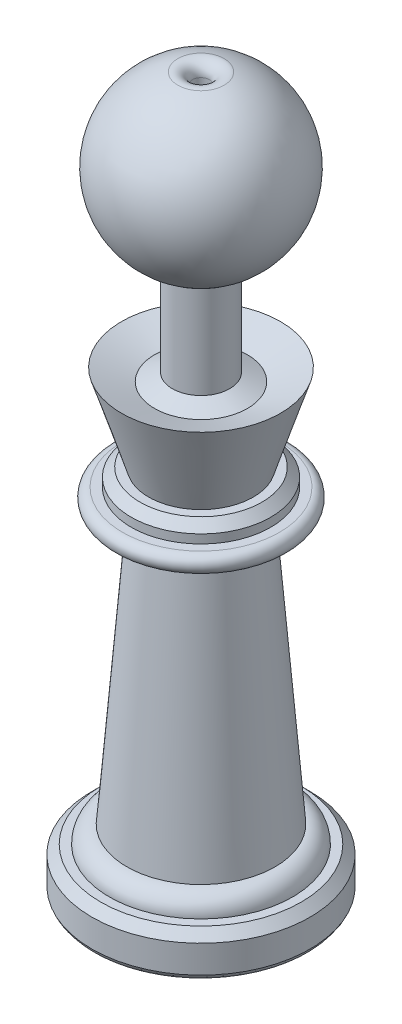
from build123d import *

# Parameters (mm, degrees)
FILLET1_R          = 1.524
CHAMFER1_SIZE      = 0.762
CHAMFER2_SIZE      = 0.762
SKETCH5_ONE_SIDE_W = 2.5
SKETCH5_ONE_SIDE_H = 12.494819280662249
SKETCH6_R          = 0.75
CUT_EXTRUDE1_DEPTH = 65
SKETCH7_R          = 5.1000000000000005
CUT_EXTRUDE2_DEPTH = 4
FILLET2_R          = 1


# Some blends are built 0.0001 mm under size
with BuildPart() as part:
    # Sketch2 → Revolve1 (revolve)
    with BuildSketch(Plane.XY, mode=Mode.PRIVATE) as revolve1_sk:
        with BuildLine():
            Line((0, 0), (0, 41.275))
            ThreePointArc((0, 41.275), (-0.736350012431866, 40.709042493331395), (-0.37888685669750244, 39.85187312123777))
            Line((-0.37888685669750244, 39.85187312123777), (-4.064000000000009, 38.1790309038726))
            Line((-4.064000000000009, 38.1790309038726), (-6.946791529476407, 39.25438129728364))
            Line((-6.946791529476407, 39.25438129728364), (-4.571999999999998, 31.72459999999999))
            Line((-4.571999999999998, 31.72459999999999), (-6.095999999999998, 31.7246))
            Line((-6.095999999999998, 31.7246), (-6.095999999999999, 30.200599999999998))
            Line((-6.095999999999999, 30.200599999999998), (-6.857999999999998, 30.2006))
            ThreePointArc((-6.857999999999998, 30.2006), (-7.619999999999999, 29.4386), (-6.858, 28.676600000000004))
            Line((-6.858, 28.676600000000004), (-4.571999999999998, 28.6766))
            Line((-4.571999999999998, 28.6766), (-6.477000000000001, 4.698999999999998))
            Line((-6.477000000000001, 4.698999999999998), (-8.001000000000001, 4.698999999999998))
            Line((-8.001000000000001, 4.698999999999998), (-8.001000000000001, 3.1749999999999985))
            Line((-8.001000000000001, 3.1749999999999985), (-9.525, 3.1749999999999985))
            Line((-9.525, 3.1749999999999985), (-9.525, -1.17e-15))
            Line((-9.525, -1.17e-15), (0, 0))
        make_face()
    revolve(revolve1_sk.sketch.rotate(Axis((0, 0, 0), (0, 1, 0)), 270), axis=Axis((0, 0, 0), (0, 1, 0)))

    # Fillet1
    fillet1_edges = [part.edges().sort_by_distance(p)[0] for p in [
        (-2.76e-15, 4.698999999999998, 8.001000000000001),
    ]]
    fillet(fillet1_edges, radius=FILLET1_R - 0.0001)  # a hair under: the kernel refuses the full size

    # Chamfer1
    chamfer1_edges = [part.edges().sort_by_distance(p)[0] for p in [
        (-3.28e-15, 3.1749999999999985, 9.525),
    ]]
    chamfer(chamfer1_edges, length=CHAMFER1_SIZE)

    # Chamfer2
    chamfer2_edges = [part.edges().sort_by_distance(p)[0] for p in [
        (-2.1e-15, 31.7246, 6.095999999999998),
    ]]
    chamfer(chamfer2_edges, length=CHAMFER2_SIZE)

    # Sketch5 one side → Revolve2 (revolve)
    with BuildSketch(Plane.XY, mode=Mode.PRIVATE) as revolve2_sk:
        with BuildLine():
            Line((0, 46.891067811865476), (0, 61.891067811865476))
            ThreePointArc((2.0363e-13, 61.891067811865476), (-7.5, 54.391067811865476), (2.0512e-13, 46.891067811865476))
        make_face()
        Polygon((0, 0), (-10, -1.22e-15), (-5.37, -2.68), (0, -2.68), align=None)
        with Locations((-1.25, 41.07259035966888)):
            Rectangle(SKETCH5_ONE_SIDE_W, SKETCH5_ONE_SIDE_H)
    revolve(revolve2_sk.sketch.rotate(Axis((0, 37.66101754504278, 0), (0, 1, 0)), 270), axis=Axis((0, 37.66101754504278, 0), (0, 1, 0)))

    # Sketch6 → Cut-Extrude1 (cut)
    with BuildSketch(Plane.XZ.offset(2.68)):
        with Locations(Location((0, 0, 0), (0, 0, 270))):
            Circle(SKETCH6_R)
    extrude(amount=-CUT_EXTRUDE1_DEPTH, mode=Mode.SUBTRACT)

    # Sketch7 → Cut-Extrude2 (cut)
    with BuildSketch(Plane.XZ.offset(2.68)):
        with Locations(Location((0, 0, 0), (0, 0, 270))):
            Circle(SKETCH7_R)
    extrude(amount=-CUT_EXTRUDE2_DEPTH, mode=Mode.SUBTRACT)

    # Fillet2
    # the kernel refuses this fillet: 1 mm, written as the material it takes off along each edge
    with BuildSketch(Plane(origin=(0, 0, 0), x_dir=(2.2e-16, 0, -1), z_dir=(1, 0, 2.2e-16))) as fillet2_piece_1:
        with BuildLine():
            CenterArc((8.582830845240167, 0.335137708739466), FILLET2_R, 300.06370450944223, 40.355383333849545)
            Line((9.083793429310001, -0.5303312331423757), (10, 0))
            Line((10, 0), (9.525, -1.44e-15))
        make_face()
    revolve(axis=Axis((0, 0, 0), (0, 1, 0)), mode=Mode.SUBTRACT)
    with BuildSketch(Plane(origin=(0, 61.85347359016512, 2.2e-16), x_dir=(2.2e-16, 0, -1), z_dir=(-1, 0, -2.2e-16))) as fillet2_piece_2:
        with BuildLine():
            CenterArc((1.7500000000000002, 1.2024137655251934), FILLET2_R, 180, 105.6184982756485)
            Line((0.7500000000000002, 1.2024137655251934), (0.75, 0))
            ThreePointArc((0.75, 0), (1.3897771193257187, 0.09229590404412846), (2.019230769230769, 0.23933807125219886))
        make_face()
    revolve(axis=Axis((0, 61.85347359016512, 2.2e-16), (0, -1, 0)), mode=Mode.SUBTRACT)
    with BuildSketch(Plane(origin=(0, -2.68, 0), x_dir=(-1.8e-16, 0, -1), z_dir=(-1, 0, 1.8e-16))) as fillet2_piece_3:
        with BuildLine():
            CenterArc((6.1000000000000005, -0.683447144993671), FILLET2_R, 136.88639405410134, 43.113605945898655)
            Line((5.37, -4.4e-16), (5.1000000000000005, 0))
            Line((5.1000000000000005, 0), (5.1000000000000005, -0.683447144993671))
        make_face()
    revolve(axis=Axis((0, -2.68, 0), (0, -1, 0)), mode=Mode.SUBTRACT)


solid = part.part
